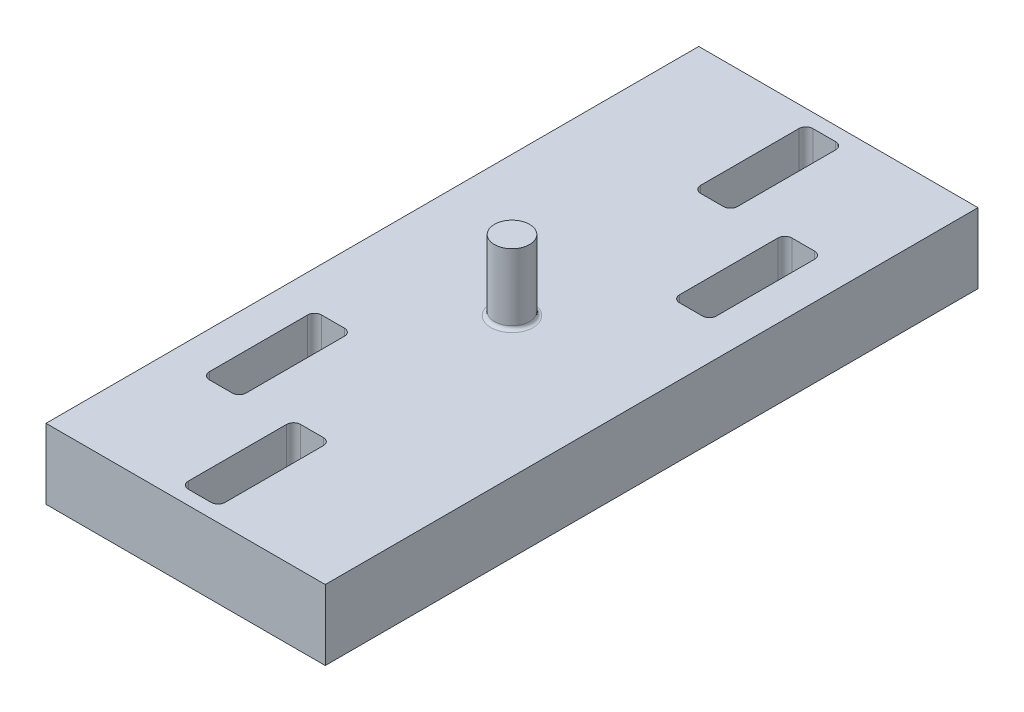
from build123d import *

# Parameters (mm, degrees)
BOSS_EXTRUDE1_DEPTH = 10
SKETCH4_W           = 5.25
SKETCH4_H           = 16
CUT_EXTRUDE1_DEPTH  = 82.115739792
SKETCH5_R           = 2.5
BOSS_EXTRUDE2_DEPTH = 10
FILLET1_R           = 0.5
FILLET2_R           = 1


with BuildPart() as part:
    # Sketch2 → Boss-Extrude1 (new body)
    with BuildSketch(Plane(origin=(0, 0, 0), x_dir=(1, 0, 0), z_dir=(0, 1, 0))):
        Polygon((-19.893799085, 78), (0, 78), (0, 76), (-2.625, 76), (-2.625, 60), (0, 60), (0, 3), (-2.625, 3), (-2.625, -13), (0, -13), (0, -15), (-19.893799085, -15), align=None)
    boss_extrude1 = extrude(amount=BOSS_EXTRUDE1_DEPTH)

    # Mirror1: Boss-Extrude1 across Right Plane
    add(boss_extrude1.mirror(Plane(origin=(0, 0, 0), x_dir=(0, 0, -1), z_dir=(1, 0, 0))))

    # Sketch4 → Cut-Extrude1 (cut, through all)
    with BuildSketch(Plane(origin=(0, 0, 0), x_dir=(1, 0, 0), z_dir=(0, 1, 0))):
        with Locations((-12.000000005, 10)):
            Rectangle(SKETCH4_W, SKETCH4_H)
        Polygon((14.625000005, 47.47), (14.625000005, 58.5), (14.625000005, 61), (9.375000005, 61), (9.375000005, 58.5), (9.375000005, 47.5), (9.375000005, 45), (14.625000005, 45), align=None)
    extrude(amount=CUT_EXTRUDE1_DEPTH, mode=Mode.SUBTRACT)

    # Sketch5 → Boss-Extrude2 (add)
    with BuildSketch(Plane(origin=(0, 10, 0), x_dir=(1, 0, 0), z_dir=(0, 1, 0))):
        with Locations((0, 31.5)):
            Circle(SKETCH5_R)
    extrude(amount=BOSS_EXTRUDE2_DEPTH)

    # Fillet1
    fillet1_edges = [part.edges().sort_by_distance(p)[0] for p in [
        (-2.5, 10, -31.5),
    ]]
    fillet(fillet1_edges, radius=FILLET1_R)

    # Fillet2
    fillet2_edges = [part.edges().sort_by_distance(p)[0] for p in [
        (2.625, 5, -60),
        (-2.625, 5, -60),
        (-2.625, 5, -76),
        (2.625, 5, -76),
        (14.625000005, 5, -61),
        (9.375000005, 5, -61),
        (9.375000005, 5, -45),
        (14.625000005, 5, -45),
        (2.625, 5, 13),
        (2.625, 5, -3),
        (-2.625, 5, -3),
        (-2.625, 5, 13),
        (-9.375000005, 5, -2),
        (-14.625000005, 5, -2),
        (-14.625000005, 5, -18),
        (-9.375000005, 5, -18),
    ]]
    fillet(fillet2_edges, radius=FILLET2_R)


solid = part.part
